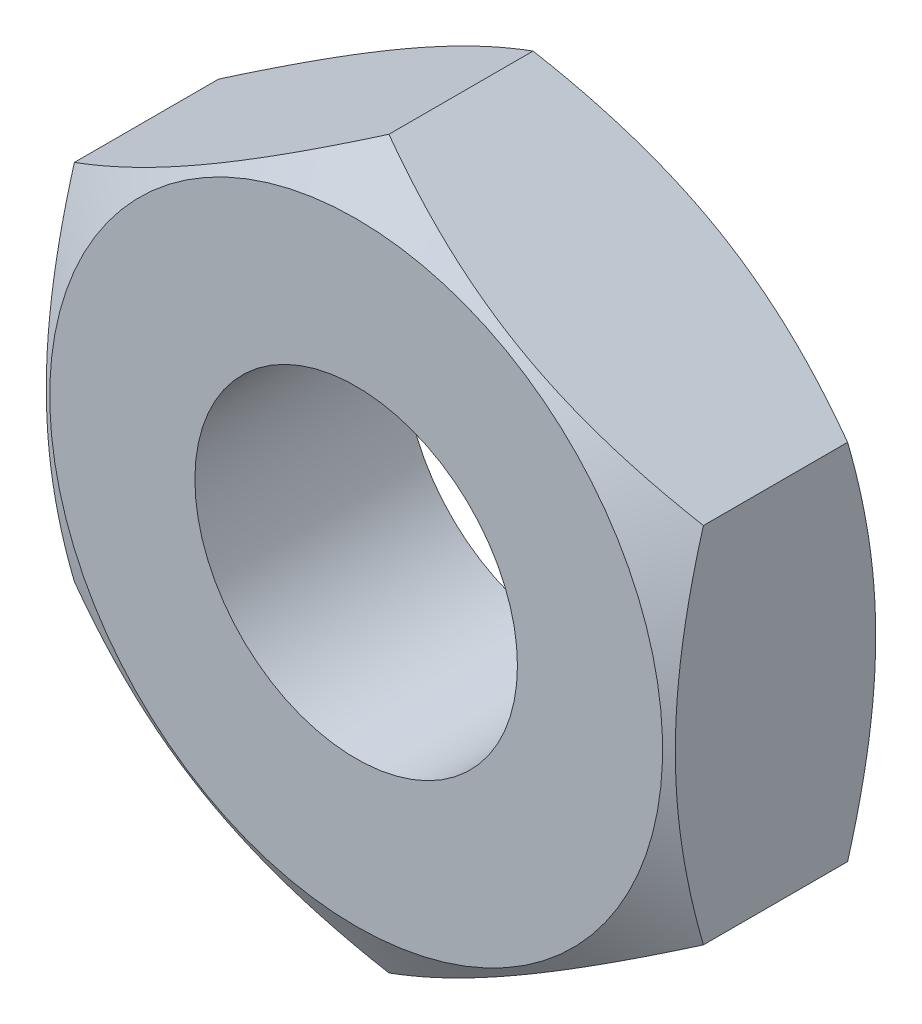
from build123d import *

# Parameters (mm, degrees)
SKETCH1_R      = 1
EXTRUDE1_DEPTH = 1.3


with BuildPart() as part:
    # Sketch1 → Extrude1 (new body)
    with BuildSketch(Plane.XY):
        Polygon((0, 2.25166605), (-1.95, 1.125833025), (-1.95, -1.125833025), (0, -2.25166605), (1.95, -1.125833025), (1.95, 1.125833025), align=None)
        Circle(SKETCH1_R, mode=Mode.SUBTRACT)
    extrude(amount=EXTRUDE1_DEPTH)

    # Sketch2 → Cut-Revolve1 (revolve, cut)
    with BuildSketch(Plane(origin=(0, 0, 0), x_dir=(0, 0, -1), z_dir=(1, 0, 0))):
        Polygon((-0.434901209, 2.65327099), (0, 1.9), (0, 2.65327099), align=None)
        Polygon((-1.3, 1.9), (-0.865098791, 2.65327099), (-1.3, 2.65327099), align=None)
    revolve(axis=Axis((0, 0, 1.3), (0, 0, -1)), mode=Mode.SUBTRACT)


solid = part.part
